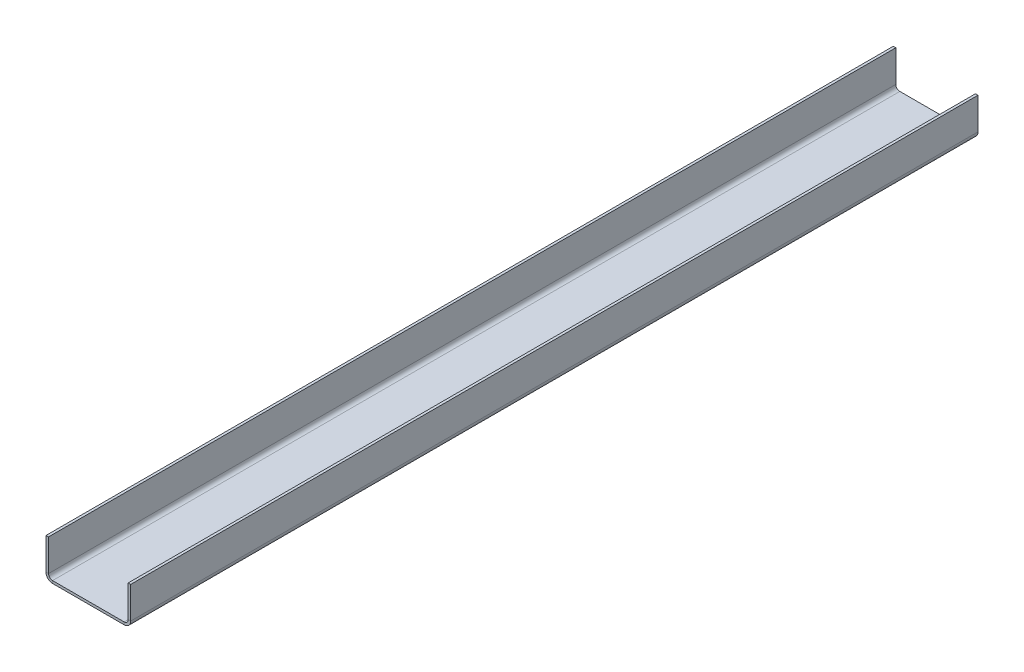
from build123d import *

# Parameters (mm, degrees)
BASE_FLANGE1_DEPTH = 420


# Sheet-metal steps are written as plain solids
with BuildPart() as part:
    # Sketch1 → Base-Flange1 (new body)
    with BuildSketch(Plane.XY):
        with BuildLine():
            Line((0, 19), (0, 3.25))
            ThreePointArc((0, 3.25), (0.951902961, 0.951902961), (3.25, 0))
            Line((3.25, 0), (38.75, 0))
            ThreePointArc((38.75, 0), (41.048097039, 0.951902961), (42, 3.25))
            Line((42, 3.25), (42, 19))
            Line((42, 19), (40.75, 19))
            Line((40.75, 19), (40.75, 3.25))
            ThreePointArc((40.75, 3.25), (40.164213562, 1.835786438), (38.75, 1.25))
            Line((38.75, 1.25), (3.25, 1.25))
            ThreePointArc((3.25, 1.25), (1.835786438, 1.835786438), (1.25, 3.25))
            Line((1.25, 3.25), (1.25, 19))
            Line((1.25, 19), (0, 19))
        make_face()
    extrude(amount=BASE_FLANGE1_DEPTH)


solid = part.part
